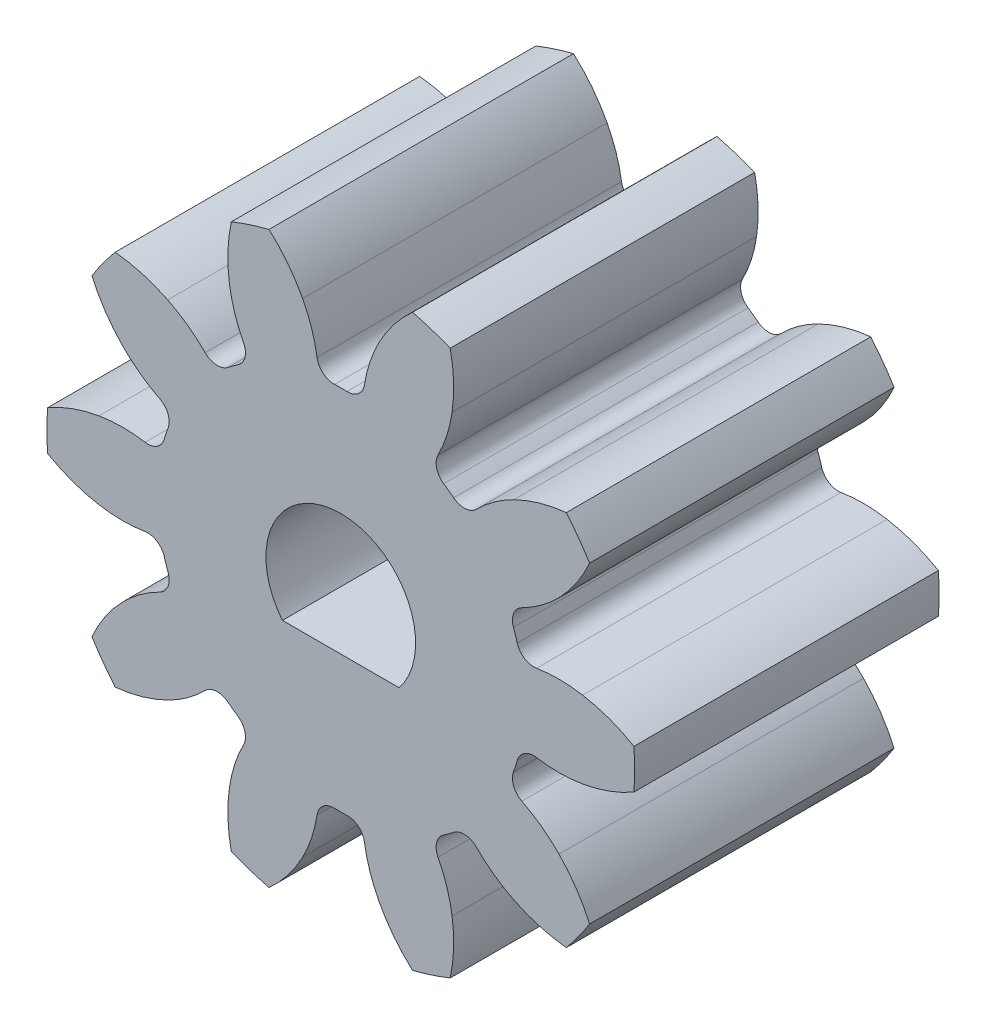
from build123d import *

# Parameters (mm, degrees)
SKETCH1_R                = 5.887500036
BLANK_DISK_DEPTH         = 3.049999996
GEAR_TOOTH_CUT_DEPTH     = 11.321594511
GEAR_TEETH_REVOLVE_COUNT = 10
HUB_EXTRUDE_DEPTH        = 11.221001365


with BuildPart() as part:
    # Sketch1 → BLANK DISK (new, symmetric)
    with BuildSketch(Plane.XY):
        Circle(SKETCH1_R)
    extrude(amount=BLANK_DISK_DEPTH, both=True)

    # Sketch2 → GEAR TOOTH CUT (cut, through all)
    with BuildSketch(Plane.XY.offset(3.049999996)):
        with BuildLine():
            ThreePointArc((-4.985659759, -3.131429935), (-5.599345274, -1.819337566), (-5.874091808, -0.397117245))
            ThreePointArc((-5.874091808, -0.397117245), (-5.376423722, -0.629962338), (-4.845327653, -0.77077188))
            ThreePointArc((-4.845327653, -0.77077188), (-4.383437981, -0.811075473), (-3.921230969, -0.774590865))
            ThreePointArc((-3.921230969, -0.774590865), (-3.682257583, -0.823363871), (-3.535926696, -1.018490385))
            ThreePointArc((-3.535926696, -1.018490385), (-3.499590796, -1.137085978), (-3.459278416, -1.254389535))
            ThreePointArc((-3.459278416, -1.254389535), (-3.462970103, -1.498261339), (-3.627635579, -1.678184561))
            ThreePointArc((-3.627635579, -1.678184561), (-4.023014022, -1.920346358), (-4.373000758, -2.224444588))
            ThreePointArc((-4.373000758, -2.224444588), (-4.719900732, -2.650532337), (-4.985659759, -3.131429935))
        make_face()
    gear_tooth_cut = extrude(amount=-GEAR_TOOTH_CUT_DEPTH, mode=Mode.SUBTRACT)

    # GEAR TEETH REVOLVE: GEAR TOOTH CUT ×10 about axis
    gear_teeth_revolve_axis = Axis((0, 0, 50), (0, 0, -1))
    for i in range(1, GEAR_TEETH_REVOLVE_COUNT):
        add(gear_tooth_cut.rotate(gear_teeth_revolve_axis, i * 360 / GEAR_TEETH_REVOLVE_COUNT), mode=Mode.SUBTRACT)

    # Sketch3 → HUB EXTRUDE (cut, through all)
    with BuildSketch(Plane.XY.offset(3.049999996)):
        with BuildLine():
            Line((-1.169092, -0.9398), (1.169092, -0.9398))
            ThreePointArc((1.169092, -0.9398), (0, 1.500000048), (-1.169092, -0.9398))
        make_face()
    extrude(amount=-HUB_EXTRUDE_DEPTH, mode=Mode.SUBTRACT)


solid = part.part
